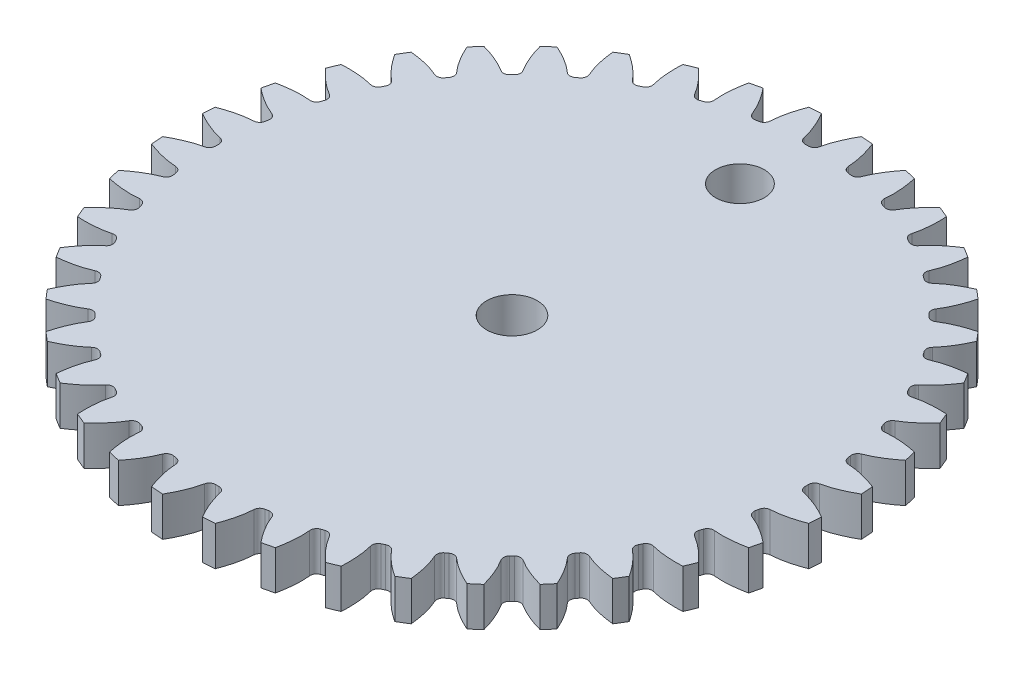
from build123d import *

# Parameters (mm, degrees)
SKETCH2_R                = 53.34
BOSS_EXTRUDE1_DEPTH      = 12.7
CUT_EXTRUDE1_DEPTH       = 12.7
FILLET2_R                = 1.016
CIRPATTERN1_COUNT        = 40
FILLET2_OF_CIRPATTERN1_R = 1.016
SKETCH4_R                = 4.09575
CUT_EXTRUDE2_DEPTH       = 77.359986682
CUT_EXTRUDE3_DEPTH       = 6.35
CUT_EXTRUDE4_DEPTH       = 77.359986682
CUT_EXTRUDE4_DEPTH_BACK  = 77.359986682
SKETCH6_R                = 3.937
SKETCH7_R                = 100.362348096
CUT_EXTRUDE6_DEPTH       = 76.56374835


with BuildPart() as part:
    # Sketch2 → Boss-Extrude1 (new body)
    with BuildSketch(Plane(origin=(0, 0, 0), x_dir=(1, 0, 0), z_dir=(0, 1, 0))):
        Circle(SKETCH2_R)
    extrude(amount=BOSS_EXTRUDE1_DEPTH)

    # Sketch3 → Cut-Extrude1 (cut)
    with BuildSketch(Plane(origin=(0, 0, 0), x_dir=(-1, 0, 0), z_dir=(0, -1, 0))):
        with BuildLine():
            Line((47.610863724, -1.16029328), (47.722215798, -1.163006969))
            add(Edge.make_bspline(
                [(47.722215798, -1.163006969), (47.730982789, -1.163313167), (47.755564012, -1.16445845), (47.802003051, -1.167754997), (47.87772523, -1.174741096), (47.974119041, -1.186004909), (48.098593622, -1.203276497), (48.245061479, -1.227112329), (48.405834144, -1.256963367), (48.580520514, -1.293386204), (48.754577285, -1.333212779), (48.927987969, -1.376189951), (49.100522746, -1.421931459), (49.30925176, -1.48080125), (49.559155717, -1.556203831), (49.850651678, -1.651349023), (50.180503564, -1.767531099), (50.515821541, -1.894787282), (50.845048793, -2.027276114), (51.176798745, -2.169495413), (51.497150175, -2.313020498), (51.828924093, -2.470658837), (52.134675109, -2.620519189), (52.476090794, -2.797888155), (52.751288045, -2.94379105), (53.034579939, -3.102405155), (53.172312998, -3.180768911), (53.242640535, -3.221308569)],
                knots=[0, 0, 0, 0, 0, 0.005376749, 0.015083688, 0.02853182, 0.04661014, 0.064854849, 0.092110526, 0.119476176, 0.146842496, 0.174208854, 0.201574956, 0.228941013, 0.256307345, 0.307035032, 0.361767352, 0.416499661, 0.471231937, 0.525964282, 0.580696616, 0.635428982, 0.690161387, 0.744893688, 0.799626082, 0.854358407, 0.909090914, 0.909090914, 0.909090914, 0.909090914, 0.909090914], degree=4))
            ThreePointArc((53.242640535, -3.221308569), (53.34, 0), (53.242640535, 3.221308569))
            add(Edge.make_bspline(
                [(53.242640535, 3.221308569), (53.172312998, 3.180768911), (53.034579939, 3.102405155), (52.751288045, 2.94379105), (52.476090794, 2.797888155), (52.134675109, 2.620519189), (51.828924093, 2.470658837), (51.497150175, 2.313020498), (51.176798745, 2.169495413), (50.845048793, 2.027276114), (50.515821541, 1.894787282), (50.180503564, 1.767531099), (49.850651678, 1.651349023), (49.559155717, 1.556203831), (49.30925176, 1.48080125), (49.100522746, 1.421931459), (48.927987969, 1.376189951), (48.754577285, 1.333212779), (48.580520514, 1.293386204), (48.405834144, 1.256963367), (48.245061479, 1.227112329), (48.098593622, 1.203276497), (47.974119041, 1.186004909), (47.87772523, 1.174741096), (47.80200305, 1.167754997), (47.755564012, 1.16445845), (47.730982789, 1.163313167), (47.722215798, 1.163006969)],
                knots=[0.484570751, 0.484570751, 0.484570751, 0.484570751, 0.484570751, 0.539303258, 0.594035583, 0.648767977, 0.703500278, 0.758232683, 0.81296505, 0.867697383, 0.922429728, 0.977162004, 1.031894313, 1.086626633, 1.13735432, 1.164720652, 1.19208671, 1.219452811, 1.246819169, 1.274185489, 1.30155114, 1.328806816, 1.347051526, 1.365129845, 1.378577977, 1.388284917, 1.393661665, 1.393661665, 1.393661665, 1.393661665, 1.393661665], degree=4))
            Line((47.722215798, 1.163006969), (47.610863724, 1.16029328))
            ThreePointArc((47.610863724, 1.16029328), (47.625, 0), (47.610863724, -1.16029328))
        make_face()
    cut_extrude1 = extrude(amount=-CUT_EXTRUDE1_DEPTH, mode=Mode.SUBTRACT)

    # Fillet2
    fillet2_edges = [part.edges().sort_by_distance(p)[0] for p in [
        (-47.610863724, 6.35, -1.16029328),
        (-47.610863724, 6.35, 1.16029328),
    ]]
    fillet(fillet2_edges, radius=FILLET2_R)

    # CirPattern1: Cut-Extrude1 ×40 about axis
    cirpattern1_axis = Axis((0, 12.7, 0), (0, 1, 0))
    for i in range(1, CIRPATTERN1_COUNT):
        add(cut_extrude1.rotate(cirpattern1_axis, i * 360 / CIRPATTERN1_COUNT), mode=Mode.SUBTRACT)

    # Fillet2 of CirPattern1
    fillet2_of_cirpattern1_edges = [part.edges().sort_by_distance(p)[0] for p in [
        (-47.206204844, 6.35, 6.301971852),
        (-46.843185127, 6.35, 8.593988141),
        (-45.639172533, 6.35, 13.609061523),
        (-44.922071849, 6.35, 15.816070492),
        (-42.948352326, 6.35, 20.581050932),
        (-41.894828074, 6.35, 22.648708697),
        (-39.200001148, 6.35, 27.046266564),
        (-37.835994591, 6.35, 28.923660528),
        (-34.486415844, 6.35, 32.845513351),
        (-32.845513351, 6.35, 34.486415844),
        (-28.923660528, 6.35, 37.835994591),
        (-27.046266564, 6.35, 39.200001148),
        (-22.648708697, 6.35, 41.894828074),
        (-20.581050932, 6.35, 42.948352326),
        (-15.816070492, 6.35, 44.922071849),
        (-13.609061523, 6.35, 45.639172533),
        (-8.593988141, 6.35, 46.843185127),
        (-6.301971852, 6.35, 47.206204844),
        (-1.16029328, 6.35, 47.610863724),
        (1.16029328, 6.35, 47.610863724),
        (6.301971852, 6.35, 47.206204844),
        (8.593988141, 6.35, 46.843185127),
        (13.609061523, 6.35, 45.639172533),
        (15.816070492, 6.35, 44.922071849),
        (20.581050932, 6.35, 42.948352326),
        (22.648708697, 6.35, 41.894828074),
        (27.046266564, 6.35, 39.200001148),
        (28.923660528, 6.35, 37.835994591),
        (32.845513351, 6.35, 34.486415844),
        (34.486415844, 6.35, 32.845513351),
        (37.835994591, 6.35, 28.923660528),
        (39.200001148, 6.35, 27.046266564),
        (41.894828074, 6.35, 22.648708697),
        (42.948352326, 6.35, 20.581050932),
        (44.922071849, 6.35, 15.816070492),
        (45.639172533, 6.35, 13.609061523),
        (46.843185127, 6.35, 8.593988141),
        (47.206204844, 6.35, 6.301971852),
        (47.610863724, 6.35, 1.16029328),
        (47.610863724, 6.35, -1.16029328),
        (47.206204844, 6.35, -6.301971852),
        (46.843185127, 6.35, -8.593988141),
        (45.639172533, 6.35, -13.609061523),
        (44.922071849, 6.35, -15.816070492),
        (42.948352326, 6.35, -20.581050932),
        (41.894828074, 6.35, -22.648708697),
        (39.200001148, 6.35, -27.046266564),
        (37.835994591, 6.35, -28.923660528),
        (34.486415844, 6.35, -32.845513351),
        (32.845513351, 6.35, -34.486415844),
        (28.923660528, 6.35, -37.835994591),
        (27.046266564, 6.35, -39.200001148),
        (22.648708697, 6.35, -41.894828074),
        (20.581050932, 6.35, -42.948352326),
        (15.816070492, 6.35, -44.922071849),
        (13.609061523, 6.35, -45.639172533),
        (8.593988141, 6.35, -46.843185127),
        (6.301971852, 6.35, -47.206204844),
        (1.16029328, 6.35, -47.610863724),
        (-1.16029328, 6.35, -47.610863724),
        (-6.301971852, 6.35, -47.206204844),
        (-8.593988141, 6.35, -46.843185127),
        (-13.609061523, 6.35, -45.639172533),
        (-15.816070492, 6.35, -44.922071849),
        (-20.581050932, 6.35, -42.948352326),
        (-22.648708697, 6.35, -41.894828074),
        (-27.046266564, 6.35, -39.200001148),
        (-28.923660528, 6.35, -37.835994591),
        (-32.845513351, 6.35, -34.486415844),
        (-34.486415844, 6.35, -32.845513351),
        (-37.835994591, 6.35, -28.923660528),
        (-39.200001148, 6.35, -27.046266564),
        (-41.894828074, 6.35, -22.648708697),
        (-42.948352326, 6.35, -20.581050932),
        (-44.922071849, 6.35, -15.816070492),
        (-45.639172533, 6.35, -13.609061523),
        (-46.843185127, 6.35, -8.593988141),
        (-47.206204844, 6.35, -6.301971852),
    ]]
    fillet(fillet2_of_cirpattern1_edges, radius=FILLET2_OF_CIRPATTERN1_R)

    # Sketch4 → Cut-Extrude2 (cut, through all)
    with BuildSketch(Plane(origin=(0, 12.7, 0), x_dir=(1, 0, 0), z_dir=(0, 1, 0))):
        Circle(SKETCH4_R)
    extrude(amount=-CUT_EXTRUDE2_DEPTH, mode=Mode.SUBTRACT)

    # Sketch5 → Cut-Extrude3 (cut)
    with BuildSketch(Plane(origin=(0, 12.7, 0), x_dir=(1, 0, 0), z_dir=(0, 1, 0))):
        Polygon((0, 7.376342509), (-6.3881, 3.688171255), (-6.3881, -3.688171255), (0, -7.376342509), (6.3881, -3.688171255), (6.3881, 3.688171255), align=None)
    extrude(amount=-CUT_EXTRUDE3_DEPTH, mode=Mode.SUBTRACT)

    # Sketch6 → Cut-Extrude4 (cut, two sides: drawn at the far end of the back side and taken through both)
    with BuildSketch(Plane(origin=(0, 12.7, 0), x_dir=(1, 0, 0), z_dir=(0, 1, 0)).offset(-CUT_EXTRUDE4_DEPTH_BACK)):
        with Locations((0, 36.83)):
            Circle(SKETCH6_R)
    extrude(amount=CUT_EXTRUDE4_DEPTH + CUT_EXTRUDE4_DEPTH_BACK, mode=Mode.SUBTRACT)

    # Sketch7 → Cut-Extrude6 (cut, through all)
    with BuildSketch(Plane(origin=(0, 6.35, 0), x_dir=(1, 0, 0), z_dir=(0, 1, 0))):
        Circle(SKETCH7_R)
    extrude(amount=CUT_EXTRUDE6_DEPTH, mode=Mode.SUBTRACT)


solid = part.part
